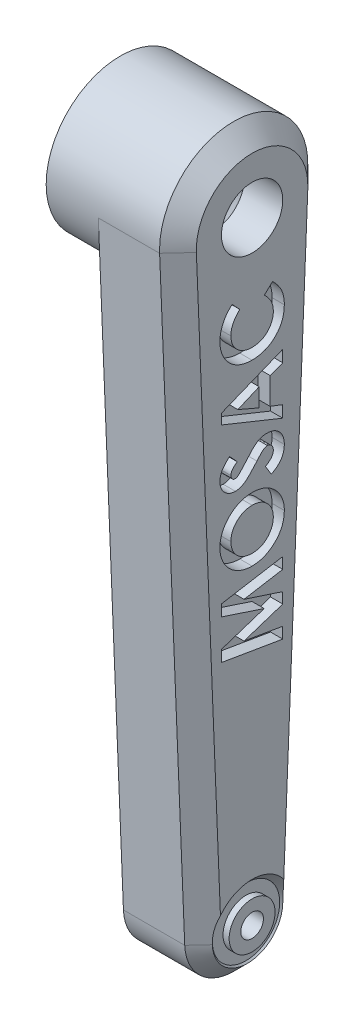
from build123d import *

# Parameters (mm, degrees)
BOSS_EXTRUDE1_DEPTH = 16
BOSS_EXTRUDE2_START = 5.5
SKETCH2_R           = 12.1
BOSS_EXTRUDE2_DEPTH = 5.5
SKETCH3_R           = 1.85
TORNILLO_INF_DEPTH  = 110.847212072
SKETCH4_R           = 1.75
TORNILLO_SUP_DEPTH  = 111.782038255
SKETCH6_R           = 10.8
SKETCH6_R_2         = 1.75
CUT_EXTRUDE4_DEPTH  = 4
SKETCH5_R           = 5
SKETCH5_R_2         = 1.65
CUT_EXTRUDE3_DEPTH  = 8.25
CHAMFER1_SIZE       = 2
CHAMFER2_SIZE       = 3
CHAMFER3_SIZE       = 3
MOSAC_DEPTH         = 2
SKETCH10_R          = 0.8
CUT_EXTRUDE5_DEPTH  = 10
SKETCH11_R          = 5.5
SKETCH11_R_2        = 3.75
CUT_EXTRUDE6_DEPTH  = 1


with BuildPart() as part:
    # Sketch1 → Boss-Extrude1 (new body)
    with BuildSketch(Plane(origin=(0, 0, 0), x_dir=(0, -1, 0), z_dir=(-1, 0, 0))):
        with BuildLine():
            Line((0.4961, -12.089825672), (100.328, -7.993273172))
            ThreePointArc((100.328, -7.993273172), (108, 0), (100.328, 7.993273172))
            Line((100.328, 7.993273172), (0.4961, 12.089825672))
            ThreePointArc((0.4961, 12.089825672), (-12.1, 0), (0.4961, -12.089825672))
        make_face()
    extrude(amount=-BOSS_EXTRUDE1_DEPTH)

    # Sketch2 → Boss-Extrude2 (add)
    with BuildSketch(Plane.ZY.offset(BOSS_EXTRUDE2_START)):
        Circle(SKETCH2_R)
    extrude(amount=-BOSS_EXTRUDE2_DEPTH)

    # Sketch3 → Tornillo_inf (cut, through all)
    with BuildSketch(Plane.ZY):
        with Locations(Location((0, -100, 0), (0, 0, 180))):
            Circle(SKETCH3_R)
    extrude(amount=-TORNILLO_INF_DEPTH, mode=Mode.SUBTRACT)

    # Sketch4 → Tornillo_sup (cut, through all)
    with BuildSketch(Plane.ZY.offset(5.5)):
        with Locations(Location((0, 0, 0), (0, 0, 180))):
            Circle(SKETCH4_R)
    extrude(amount=-TORNILLO_SUP_DEPTH, mode=Mode.SUBTRACT)

    # Sketch6 → Cut-Extrude4 (cut)
    with BuildSketch(Plane.ZY.offset(5.5)):
        with Locations(Location((0, 0, 0), (0, 0, 180))):
            Circle(SKETCH6_R)
        Circle(SKETCH6_R_2, mode=Mode.SUBTRACT)
    extrude(amount=-CUT_EXTRUDE4_DEPTH, mode=Mode.SUBTRACT)

    # Sketch5 → Cut-Extrude3 (cut)
    with BuildSketch(Plane(origin=(16, 0, 0), x_dir=(0, 0, -1), z_dir=(1, 0, 0))):
        with Locations(Location((0, 0, 0), (0, 0, 180))):
            Circle(SKETCH5_R)
        Circle(SKETCH5_R_2, mode=Mode.SUBTRACT)
    extrude(amount=-CUT_EXTRUDE3_DEPTH, mode=Mode.SUBTRACT)

    # Chamfer1
    chamfer1_edges = [part.edges().sort_by_distance(p)[0] for p in [
        (7.75, 0, -5),
    ]]
    chamfer(chamfer1_edges, length=CHAMFER1_SIZE)

    # Chamfer2
    # the kernel refuses this chamfer: 3 mm, written as the material it takes off along each edge
    with BuildSketch(Plane(origin=(0, -100.328, 7.993273172), x_dir=(1, 0, 0), z_dir=(0, 0.9991591464826812, 0.041000000000000016))) as chamfer2_piece_1_section:
        Polygon((CHAMFER2_SIZE, 0), (0, CHAMFER2_SIZE), (0, 0), align=None)
    chamfer2_piece_1 = extrude(amount=113.031497887, mode=Mode.PRIVATE)
    chamfer2_piece_1 = chamfer2_piece_1 - Plane(origin=(0, 0, 0), x_dir=(0, -0.041000000000000016, 0.9991591464826812), z_dir=(-1, 0, 0)) * Cylinder(12.1, 239, mode=Mode.PRIVATE)
    add(chamfer2_piece_1, mode=Mode.SUBTRACT)
    with BuildSketch(Plane(origin=(0, -100, 0), x_dir=(0, -0.041000000000003894, -0.9991591464826811), z_dir=(0, 0.9991591464826811, -0.041000000000003894))) as chamfer2_piece_2:
        Polygon((8, -CHAMFER2_SIZE), (8 - CHAMFER2_SIZE, 0), (8, 0), align=None)
    revolve(axis=Axis((0, -100, 0), (-1, 0, 0)), revolution_arc=175.300428789, mode=Mode.SUBTRACT)
    with BuildSketch(Plane(origin=(0, 12.608454954, -12.627564585), x_dir=(1, 0, 0), z_dir=(0, -0.9991591464826812, 0.041))) as chamfer2_piece_3_section:
        Polygon((CHAMFER2_SIZE, 0), (0, CHAMFER2_SIZE), (0, 0), align=None)
    chamfer2_piece_3 = extrude(amount=113.031497887, mode=Mode.PRIVATE)
    chamfer2_piece_3 = chamfer2_piece_3 - Plane(origin=(0, 0, 0), x_dir=(0, -0.041000000000000016, 0.9991591464826812), z_dir=(-1, 0, 0)) * Cylinder(12.1, 239, mode=Mode.PRIVATE)
    add(chamfer2_piece_3, mode=Mode.SUBTRACT)

    # Chamfer3
    # the kernel refuses this chamfer: 3 mm, written as the material it takes off along each edge
    with BuildSketch(Plane(origin=(16, -100, 0), x_dir=(0, -0.041000000000003894, -0.9991591464826811), z_dir=(0, 0.9991591464826811, -0.041000000000003894))) as chamfer3_piece_1:
        Polygon((8 - CHAMFER3_SIZE, 0), (8, CHAMFER3_SIZE), (8, 0), align=None)
    revolve(axis=Axis((16, -100, 0), (-1, 0, 0)), revolution_arc=175.300428789, mode=Mode.SUBTRACT)
    with BuildSketch(Plane(origin=(16, -100.328, 7.993273172), x_dir=(0, 0.041000000000000016, -0.9991591464826812), z_dir=(0, 0.9991591464826812, 0.041000000000000016)), Plane(origin=(16, -0.4961, -12.089825672), x_dir=(0, 0.040999999999999995, 0.9991591464826812), z_dir=(0, -0.9991591464826812, 0.041))) as chamfer3_piece_2:
        Polygon((CHAMFER3_SIZE, 0), (0, CHAMFER3_SIZE), (0, 0), align=None)
    extrude(amount=99.915914648, mode=Mode.SUBTRACT)
    with BuildSketch(Plane(origin=(16, 0, 0), x_dir=(0, -0.041000000000000016, 0.9991591464826812), z_dir=(0, -0.9991591464826812, -0.041000000000000016))) as chamfer3_piece_3:
        Polygon((12.1 - CHAMFER3_SIZE, 0), (12.1, CHAMFER3_SIZE), (12.1, 0), align=None)
    revolve(axis=Axis((16, 0, 0), (-1, 0, 0)), revolution_arc=184.699571211, mode=Mode.SUBTRACT)

    # Sketch9 → MOSAC (cut)
    # profile 1 of 5: a face of its own
    with BuildSketch(Plane(origin=(16, 0, 0), x_dir=(0, 0, -1), z_dir=(1, 0, 0))):
        with BuildLine():
            Line((-3.265224359, -10.641025641), (-2.007211538, -11.95713141))
            add(Edge.make_bspline(
                [(-2.007211538, -11.95713141), (-2.122670398, -12.068763826), (-2.348197722, -12.286816907), (-2.646445689, -12.638360029), (-2.896039484, -13.003018088), (-3.102028707, -13.377152323), (-3.264159895, -13.761494968), (-3.378804441, -14.157335015), (-3.449477952, -14.564094076), (-3.457502386, -14.839462049), (-3.461538462, -14.977964744)],
                knots=[0, 0, 0, 0, 1.115315123, 2.178559852, 3.196385012, 4.180486591, 5.141138664, 6.08807191, 7.038351522, 8, 8, 8, 8], degree=3))
            add(Edge.make_bspline(
                [(-3.461538462, -14.977964744), (-3.458340396, -15.093626948), (-3.452029365, -15.321873564), (-3.405651796, -15.656967742), (-3.327082201, -15.977624173), (-3.217871035, -16.284097259), (-3.080337556, -16.577902235), (-2.90746789, -16.856303257), (-2.705031769, -17.120796478), (-2.473383434, -17.368291517), (-2.218417825, -17.591726), (-1.949893333, -17.793043645), (-1.663060411, -17.95979365), (-1.36210196, -18.095911492), (-1.046909305, -18.20317548), (-0.717498223, -18.279305037), (-0.37312496, -18.323414553), (-0.139014085, -18.329990993), (-0.020032051, -18.333333333)],
                knots=[0, 0, 0, 0, 1.035268443, 2.04298821, 3.02163646, 3.985902049, 4.951223231, 5.920091634, 6.913651787, 7.92868536, 8.949353712, 9.945284791, 10.92850487, 11.913014323, 12.897904816, 13.904240668, 14.934873455, 16, 16, 16, 16], degree=3))
            add(Edge.make_bspline(
                [(-0.020032051, -18.333333333), (0.063474991, -18.33235513), (0.228069088, -18.330427071), (0.470931174, -18.309896989), (0.707046168, -18.275707578), (0.935846594, -18.228081492), (1.157631207, -18.167028798), (1.372919337, -18.096502415), (1.579144107, -18.00642222), (1.780166807, -17.907335194), (1.97114841, -17.79333868), (2.152214652, -17.668512149), (2.323406062, -17.534006), (2.484113945, -17.388023888), (2.632024799, -17.228727581), (2.771166034, -17.059964327), (2.899342845, -16.880057594), (3.014514105, -16.688935276), (3.121865929, -16.492380945), (3.210763566, -16.286345345), (3.290678247, -16.076591677), (3.350797897, -15.859438602), (3.403089354, -15.638711676), (3.435025359, -15.411338473), (3.459292504, -15.179476881), (3.460786586, -15.022770462), (3.461538462, -14.943910256)],
                knots=[0, 0, 0, 0, 1.103738238, 2.175490744, 3.219137561, 4.256155604, 5.262629953, 6.259184223, 7.247888397, 8.234817694, 9.220364322, 10.185094651, 11.140491148, 12.096499151, 13.05201798, 14.011605636, 14.986460005, 15.968997565, 16.960259839, 17.944382265, 18.933125845, 19.924977513, 20.920749559, 21.929466621, 22.958034467, 24, 24, 24, 24], degree=3))
            add(Edge.make_bspline(
                [(3.461538462, -14.943910256), (3.457684031, -14.81014541), (3.450111076, -14.547332269), (3.39045925, -14.161708182), (3.293379843, -13.793654423), (3.175427434, -13.500643614), (3.061055847, -13.270945977), (2.9582409, -13.094614001), (2.839711638, -12.914207467), (2.704975877, -12.730001121), (2.554622348, -12.540925796), (2.385713195, -12.350110431), (2.203708052, -12.152731266), (2.073811768, -12.023427728), (2.007211538, -11.95713141)],
                knots=[0, 0, 0, 0, 1.404693586, 2.759857621, 4.088769373, 5.395275838, 6.0697462, 6.783214465, 7.53810233, 8.336454657, 9.18000028, 10.074808326, 11.012918585, 12, 12, 12, 12], degree=3))
            Line((2.007211538, -11.95713141), (3.347355769, -10.681089744))
            add(Edge.make_bspline(
                [(3.347355769, -10.681089744), (3.433957203, -10.770788604), (3.602984682, -10.945861598), (3.84298793, -11.209954348), (4.058657528, -11.473714728), (4.257821337, -11.730770835), (4.434677233, -11.985333516), (4.589401843, -12.237375776), (4.725908376, -12.484044387), (4.841894718, -12.7304615), (4.940379168, -12.978160451), (5.025167815, -13.233013563), (5.09689596, -13.495799945), (5.154771154, -13.768124578), (5.201179245, -14.047447383), (5.232504439, -14.33638245), (5.253563324, -14.633097788), (5.255455639, -14.834364399), (5.256410256, -14.935897436)],
                knots=[0, 0, 0, 0, 1.244526981, 2.429050516, 3.560637417, 4.644440555, 5.67424972, 6.652764056, 7.595344123, 8.486817594, 9.369275933, 10.254498637, 11.166417451, 12.086725134, 13.032340136, 13.991389299, 14.986715468, 16, 16, 16, 16], degree=3))
            add(Edge.make_bspline(
                [(5.256410256, -14.935897436), (5.251655907, -15.122401047), (5.242352968, -15.487336773), (5.173424486, -16.022140563), (5.057867099, -16.530189808), (4.894437081, -17.012720496), (4.685662892, -17.469579194), (4.42971554, -17.900649023), (4.127275036, -18.305235195), (3.781886277, -18.68006945), (3.400433388, -19.019124872), (2.990857633, -19.318810601), (2.551146098, -19.566710647), (2.087794725, -19.772547397), (1.598689064, -19.933509028), (1.08330005, -20.046798729), (0.542125324, -20.116663661), (0.172490511, -20.124306984), (-0.016025641, -20.128205128)],
                knots=[0, 0, 0, 0, 1.078019885, 2.10938526, 3.111377082, 4.085535484, 5.04941344, 6.010039228, 6.978205633, 7.964457913, 8.951525778, 9.924444315, 10.892603023, 11.863865945, 12.85144698, 13.863884204, 14.910567087, 16, 16, 16, 16], degree=3))
            add(Edge.make_bspline(
                [(-0.016025641, -20.128205128), (-0.138977219, -20.126574198), (-0.382637196, -20.123342092), (-0.742174993, -20.088735451), (-1.09222087, -20.041730476), (-1.429783559, -19.964515279), (-1.75870541, -19.874749197), (-2.076075658, -19.759098917), (-2.383231183, -19.624736199), (-2.679784053, -19.471318919), (-2.962531891, -19.295602499), (-3.233277873, -19.10429402), (-3.488514775, -18.89275375), (-3.729294905, -18.663122748), (-3.958345513, -18.417522992), (-4.170033485, -18.151748265), (-4.370037908, -17.870331254), (-4.552393868, -17.571322534), (-4.718243478, -17.261535606), (-4.860928314, -16.942475764), (-4.983357132, -16.618256186), (-5.084153228, -16.287893792), (-5.159595852, -15.95080443), (-5.216647963, -15.609246813), (-5.248552504, -15.26035424), (-5.253774319, -15.026101683), (-5.256410256, -14.907852564)],
                knots=[0, 0, 0, 0, 1.071814294, 2.12407397, 3.147667899, 4.14936388, 5.141177959, 6.119239245, 7.091825145, 8.063277363, 9.028022524, 9.992609517, 10.952139039, 11.915934802, 12.892469547, 13.878248468, 14.87668965, 15.901326483, 16.93027266, 17.938917451, 18.9468897, 19.950817235, 20.948103127, 21.957084021, 22.968749718, 24, 24, 24, 24], degree=3))
            add(Edge.make_bspline(
                [(-5.256410256, -14.907852564), (-5.254897705, -14.806974508), (-5.251888328, -14.606267247), (-5.226846238, -14.307372217), (-5.187406226, -14.01090033), (-5.12831547, -13.717756918), (-5.056753843, -13.426623729), (-4.968609238, -13.138719663), (-4.861093479, -12.854838622), (-4.74215836, -12.572519584), (-4.606756902, -12.297392981), (-4.455201501, -12.031849849), (-4.291456992, -11.77523222), (-4.112706943, -11.529087071), (-3.921576961, -11.291680697), (-3.718073371, -11.063266406), (-3.498504671, -10.846036006), (-3.343377572, -10.7097079), (-3.265224359, -10.641025641)],
                knots=[0, 0, 0, 0, 0.996333415, 1.982307736, 2.96084097, 3.949129141, 4.93457382, 5.921430247, 6.92116383, 7.931890485, 8.946633814, 9.948019707, 10.950686436, 11.952094051, 12.951305284, 13.960287133, 14.972390273, 16, 16, 16, 16], degree=3))
        make_face()
    # profile 2 of 5: a face of its own
    with BuildSketch(Plane(origin=(16, 0, 0), x_dir=(0, 0, -1), z_dir=(1, 0, 0))):
        Polygon((-5, -26.79286859), (-5, -25.128205128), (5, -21.08974359), (5, -23.006810897), (2.948717949, -23.784054487), (2.948717949, -28.141025641), (5, -28.918269231), (5, -30.833333333), align=None)
        Polygon((-2.317708333, -25.961538462), (1.153846154, -27.459935897), (1.153846154, -24.463141026), align=None, mode=Mode.SUBTRACT)
    # profile 3 of 5: a face of its own
    with BuildSketch(Plane(origin=(16, 0, 0), x_dir=(0, 0, -1), z_dir=(1, 0, 0))):
        with BuildLine():
            Line((-3.663862179, -31.923076923), (-2.435897436, -33.265224359))
            add(Edge.make_bspline(
                [(-2.435897436, -33.265224359), (-2.516995655, -33.3227162), (-2.672692925, -33.433092518), (-2.881175241, -33.612001016), (-3.059026171, -33.79010165), (-3.205502736, -33.969044415), (-3.319714983, -34.150415391), (-3.400578516, -34.333899745), (-3.451984231, -34.518457252), (-3.45838548, -34.642451408), (-3.461538462, -34.703525641)],
                knots=[0, 0, 0, 0, 1.299362458, 2.494594718, 3.587462134, 4.587049575, 5.512617175, 6.380583204, 7.202344345, 8, 8, 8, 8], degree=3))
            add(Edge.make_bspline(
                [(-3.461538462, -34.703525641), (-3.45959999, -34.760522053), (-3.45585731, -34.870567149), (-3.416783301, -35.026713875), (-3.353641804, -35.167038087), (-3.2664219, -35.287801928), (-3.162256026, -35.384953812), (-3.051366369, -35.460495203), (-2.930460129, -35.504392453), (-2.847540513, -35.510029728), (-2.806490385, -35.512820513)],
                knots=[0, 0, 0, 0, 1.184157716, 2.286297433, 3.324836695, 4.370048774, 5.362957217, 6.276446515, 7.146738784, 8, 8, 8, 8], degree=3))
            add(Edge.make_bspline(
                [(-2.806490385, -35.512820513), (-2.764867563, -35.51105395), (-2.681044985, -35.507496337), (-2.558192557, -35.47313464), (-2.438151434, -35.421341752), (-2.36507669, -35.371851532), (-2.327724359, -35.346554487)],
                knots=[0, 0, 0, 0, 0.967525499, 1.948461899, 2.951351359, 4, 4, 4, 4], degree=3))
            add(Edge.make_bspline(
                [(-2.327724359, -35.346554487), (-2.298773648, -35.323467376), (-2.231747876, -35.270016822), (-2.123989566, -35.171101202), (-1.996621727, -35.04194101), (-1.846997936, -34.885746014), (-1.673697601, -34.703061091), (-1.479615566, -34.491053998), (-1.266639437, -34.248175725), (-1.116492345, -34.077822416), (-1.037660256, -33.98838141)],
                knots=[0, 0, 0, 0, 0.473854981, 1.097054127, 1.870604305, 2.795416232, 3.865517794, 5.093525133, 6.47400653, 8, 8, 8, 8], degree=3))
            add(Edge.make_bspline(
                [(-1.037660256, -33.98838141), (-0.964880502, -33.904243663), (-0.826759647, -33.744567698), (-0.630396888, -33.517668445), (-0.454526992, -33.316963476), (-0.297832993, -33.144278123), (-0.166767748, -32.99445214), (-0.053267944, -32.874111984), (0.037701295, -32.778107347), (0.092709732, -32.723587963), (0.116185897, -32.700320513)],
                knots=[0, 0, 0, 0, 1.543627419, 2.929484142, 4.163674036, 5.24627963, 6.164986907, 6.925413438, 7.541394495, 8, 8, 8, 8], degree=3))
            add(Edge.make_bspline(
                [(0.116185897, -32.700320513), (0.211733122, -32.612044602), (0.395408443, -32.442347299), (0.679975362, -32.221665515), (0.957525594, -32.040836138), (1.232594987, -31.899311887), (1.511534608, -31.79340993), (1.800360209, -31.7192166), (2.101264754, -31.674106208), (2.306200839, -31.66916559), (2.409855769, -31.666666667)],
                knots=[0, 0, 0, 0, 1.206593015, 2.319495511, 3.336910718, 4.276265636, 5.184178927, 6.099356736, 7.038670786, 8, 8, 8, 8], degree=3))
            add(Edge.make_bspline(
                [(2.409855769, -31.666666667), (2.510851259, -31.668456682), (2.709008167, -31.671968758), (2.998981296, -31.714984948), (3.276498131, -31.776323526), (3.538539053, -31.871163672), (3.789404813, -31.986754471), (4.025189841, -32.131663515), (4.248272334, -32.301841986), (4.454695065, -32.496882459), (4.641919285, -32.712658472), (4.808922891, -32.943958714), (4.945710144, -33.193930913), (5.062856754, -33.457596414), (5.146220452, -33.739769016), (5.21180528, -34.035305957), (5.250228899, -34.347279021), (5.254320117, -34.560526379), (5.256410256, -34.669471154)],
                knots=[0, 0, 0, 0, 1.043169307, 2.046737005, 3.02462096, 3.976528701, 4.921503154, 5.875710796, 6.831116189, 7.817539083, 8.805892356, 9.780872653, 10.7604363, 11.74661763, 12.757588865, 13.796088471, 14.874055702, 16, 16, 16, 16], degree=3))
            add(Edge.make_bspline(
                [(5.256410256, -34.669471154), (5.254894093, -34.75499807), (5.251891221, -34.924390414), (5.227340535, -35.174041019), (5.187804518, -35.415137938), (5.130836659, -35.64726533), (5.059639183, -35.872239293), (4.968748943, -36.087866825), (4.864261805, -36.295697547), (4.74393265, -36.495304242), (4.604100618, -36.685428196), (4.450239656, -36.87139756), (4.274895994, -37.047086541), (4.081473928, -37.216432453), (3.868787191, -37.377250006), (3.640063154, -37.535029759), (3.390981258, -37.682696067), (3.216251359, -37.773918452), (3.127003205, -37.820512821)],
                knots=[0, 0, 0, 0, 1.016956594, 2.014157282, 2.980233409, 3.920138626, 4.854357287, 5.783465618, 6.699725051, 7.61900777, 8.551402113, 9.504102091, 10.486778735, 11.499758944, 12.559144124, 13.656050795, 14.802762778, 16, 16, 16, 16], degree=3))
            Line((3.127003205, -37.820512821), (2.179487179, -36.241987179))
            add(Edge.make_bspline(
                [(2.179487179, -36.241987179), (2.28079579, -36.183704863), (2.475013056, -36.071972682), (2.735968567, -35.882632056), (2.959433767, -35.68866225), (3.141458893, -35.485578857), (3.284477855, -35.275851295), (3.386689127, -35.058466531), (3.449957789, -34.833271834), (3.457684354, -34.679879437), (3.461538462, -34.603365385)],
                knots=[0, 0, 0, 0, 1.283663364, 2.460892379, 3.537111102, 4.529833553, 5.449777664, 6.316464042, 7.160231139, 8, 8, 8, 8], degree=3))
            add(Edge.make_bspline(
                [(3.461538462, -34.603365385), (3.458390988, -34.525539639), (3.452284432, -34.374546358), (3.395880012, -34.159022771), (3.307320934, -33.961422586), (3.180959342, -33.790618446), (3.035118859, -33.645992269), (2.872864653, -33.539249848), (2.69730952, -33.47219354), (2.575357376, -33.465104063), (2.514022436, -33.461538462)],
                knots=[0, 0, 0, 0, 1.13588714, 2.203786484, 3.234766741, 4.283437687, 5.291419208, 6.222934724, 7.106237994, 8, 8, 8, 8], degree=3))
            add(Edge.make_bspline(
                [(2.514022436, -33.461538462), (2.456960255, -33.464831148), (2.341043897, -33.471519926), (2.168694913, -33.520787399), (1.99642431, -33.597807488), (1.8551233, -33.688927685), (1.736815795, -33.781653894), (1.634307694, -33.870321065), (1.521054187, -33.978294224), (1.396912812, -34.105299598), (1.26079072, -34.249659116), (1.11270124, -34.411494381), (0.953948864, -34.592658579), (0.845808314, -34.720705791), (0.789262821, -34.787660256)],
                knots=[0, 0, 0, 0, 0.916159276, 1.861089862, 2.860218735, 3.940849679, 4.552606315, 5.27541173, 6.11797699, 7.06649574, 8.129236253, 9.306560635, 10.591630461, 12, 12, 12, 12], degree=3))
            add(Edge.make_bspline(
                [(0.789262821, -34.787660256), (0.681569185, -34.914943467), (0.474872501, -35.159238475), (0.169586796, -35.504456619), (-0.115726414, -35.815535036), (-0.384612677, -36.089760965), (-0.632047317, -36.330712197), (-0.860226964, -36.536493808), (-1.070758671, -36.70600298), (-1.321791003, -36.881952339), (-1.624971142, -37.051154693), (-1.989500962, -37.197668112), (-2.354351525, -37.291829928), (-2.599628857, -37.302460177), (-2.720352564, -37.307692308)],
                knots=[0, 0, 0, 0, 1.345561566, 2.582539916, 3.71901348, 4.751744315, 5.681651107, 6.506005906, 7.230637833, 7.861516384, 8.978504332, 10.023243174, 11.027054763, 12, 12, 12, 12], degree=3))
            add(Edge.make_bspline(
                [(-2.720352564, -37.307692308), (-2.805967161, -37.305523139), (-2.974637114, -37.301249643), (-3.222642365, -37.263130738), (-3.461944021, -37.206157451), (-3.69168116, -37.123427353), (-3.911520685, -37.016012139), (-4.122711115, -36.885716155), (-4.323035439, -36.729488735), (-4.514464168, -36.555668889), (-4.687609993, -36.361848506), (-4.840349848, -36.155592802), (-4.970052475, -35.937806368), (-5.074168603, -35.707650092), (-5.156816218, -35.467003852), (-5.214714185, -35.215259678), (-5.249330876, -34.952890506), (-5.254021063, -34.774411335), (-5.256410256, -34.68349359)],
                knots=[0, 0, 0, 0, 1.010608097, 1.99100651, 2.956992389, 3.912457524, 4.868345712, 5.842283282, 6.837666818, 7.864758285, 8.892394644, 9.901925088, 10.892014243, 11.880216914, 12.880338321, 13.892361018, 14.926363314, 16, 16, 16, 16], degree=3))
            add(Edge.make_bspline(
                [(-5.256410256, -34.68349359), (-5.252100165, -34.565670975), (-5.243514004, -34.330955795), (-5.176369764, -33.983924297), (-5.070787022, -33.644951741), (-4.943385989, -33.371822721), (-4.820034194, -33.154448374), (-4.706284099, -32.988005034), (-4.576473449, -32.817650061), (-4.426943603, -32.646020341), (-4.262599215, -32.468949596), (-4.079652016, -32.289053858), (-3.879984047, -32.104416827), (-3.737164842, -31.984582489), (-3.663862179, -31.923076923)],
                knots=[0, 0, 0, 0, 1.282949271, 2.555771389, 3.837399776, 5.142782039, 5.830402679, 6.558840402, 7.337330299, 8.162747002, 9.037840561, 9.968992266, 10.957575255, 12, 12, 12, 12], degree=3))
        make_face()
    # profile 4 of 5: a face of its own
    with BuildSketch(Plane(origin=(16, 0, 0), x_dir=(0, 0, -1), z_dir=(1, 0, 0))):
        with BuildLine():
            add(Edge.make_bspline(
                [(-5.256410256, -44.018429487), (-5.251907775, -43.84456777), (-5.243018858, -43.501325362), (-5.168949834, -42.996530315), (-5.048197682, -42.510103166), (-4.880581642, -42.042092129), (-4.660670104, -41.594623488), (-4.398546843, -41.163336098), (-4.082818236, -40.753692452), (-3.724729187, -40.367107798), (-3.335069477, -40.009947248), (-2.915545991, -39.700546389), (-2.47668579, -39.435977586), (-2.016825689, -39.218320326), (-1.534397861, -39.051130011), (-1.031412607, -38.934318888), (-0.507733702, -38.859177697), (-0.151168784, -38.850542506), (0.030048077, -38.846153846)],
                knots=[0, 0, 0, 0, 1.014235534, 2.002330665, 2.970116157, 3.9352621, 4.897279957, 5.875024536, 6.875755618, 7.909865842, 8.947091691, 9.955591861, 10.946663836, 11.933282567, 12.91916997, 13.920121047, 14.942943865, 16, 16, 16, 16], degree=3))
            add(Edge.make_bspline(
                [(0.030048077, -38.846153846), (0.209222483, -38.850829097), (0.562291399, -38.860041829), (1.081152398, -38.931236763), (1.578720248, -39.050089684), (2.056006308, -39.213989114), (2.510603863, -39.428079025), (2.944410473, -39.688121295), (3.35593834, -39.99685528), (3.743453404, -40.34688369), (4.097598256, -40.729848741), (4.407649228, -41.137738391), (4.670313656, -41.565691591), (4.886615815, -42.013373172), (5.049783973, -42.484009141), (5.171798855, -42.972286978), (5.242381063, -43.482178034), (5.251686828, -43.828580025), (5.256410256, -44.004407051)],
                knots=[0, 0, 0, 0, 1.051628416, 2.072267533, 3.067761847, 4.050852917, 5.029392597, 6.012272624, 7.015026456, 8.044749159, 9.073964344, 10.072810436, 11.047668484, 12.017263184, 12.98554948, 13.966731695, 14.967951888, 16, 16, 16, 16], degree=3))
            add(Edge.make_bspline(
                [(5.256410256, -44.004407051), (5.252222258, -44.188314896), (5.243993415, -44.549668672), (5.166400989, -45.078642814), (5.048101004, -45.584723447), (4.876831089, -46.066523897), (4.654289681, -46.523669619), (4.385587912, -46.958210717), (4.065535441, -47.366879056), (3.703785592, -47.748312425), (3.307849261, -48.093851726), (2.889604278, -48.398868459), (2.452213582, -48.656154197), (1.995480821, -48.865722158), (1.522242297, -49.030936947), (1.029616428, -49.147477252), (0.518784555, -49.216320381), (0.171817341, -49.22590983), (-0.00400641, -49.230769231)],
                knots=[0, 0, 0, 0, 1.067953136, 2.098381936, 3.099641766, 4.083805132, 5.062469929, 6.048665414, 7.046702845, 8.073106546, 9.098695993, 10.09591865, 11.076726721, 12.041940862, 13.011263376, 13.984305721, 14.978557872, 16, 16, 16, 16], degree=3))
            add(Edge.make_bspline(
                [(-0.00400641, -49.230769231), (-0.122291255, -49.229243625), (-0.357363188, -49.22621173), (-0.705730803, -49.189706598), (-1.047286963, -49.137115899), (-1.380725369, -49.059462585), (-1.708793046, -48.964516989), (-2.028567275, -48.843112764), (-2.34221663, -48.703141644), (-2.646225737, -48.541308436), (-2.937092877, -48.3583553), (-3.217318592, -48.162980138), (-3.47956919, -47.947743624), (-3.726641717, -47.717044516), (-3.957589769, -47.470111669), (-4.172173275, -47.20644728), (-4.372848112, -46.927945191), (-4.556950235, -46.634579792), (-4.719685751, -46.328520933), (-4.865416261, -46.016522336), (-4.985048051, -45.697287459), (-5.083545079, -45.372687158), (-5.162699394, -45.043180186), (-5.215305333, -44.706147564), (-5.251795941, -44.364453841), (-5.254868501, -44.134044667), (-5.256410256, -44.018429487)],
                knots=[0, 0, 0, 0, 1.034634222, 2.056167603, 3.061938024, 4.056975325, 5.049831446, 6.048294015, 7.047371884, 8.053753139, 9.058980286, 10.052730068, 11.041053953, 12.024946181, 13.008838409, 13.997162294, 14.997691456, 16.01096975, 17.025258359, 18.029177048, 19.022170708, 20.005507574, 20.996177714, 21.984639769, 22.988728483, 24, 24, 24, 24], degree=3))
        make_face()
        with BuildLine():
            add(Edge.make_bspline(
                [(-3.461538462, -44.046474359), (-3.45839884, -44.163483634), (-3.452202483, -44.39441312), (-3.404994627, -44.73314462), (-3.329598314, -45.058338823), (-3.220387676, -45.368193047), (-3.081390252, -45.664050229), (-2.913091715, -45.946434832), (-2.709706992, -46.211436412), (-2.482154901, -46.46258851), (-2.228609577, -46.689463103), (-1.956892643, -46.889913963), (-1.667457861, -47.057659046), (-1.362994012, -47.198146605), (-1.04007748, -47.3039026), (-0.701237706, -47.379229424), (-0.345890852, -47.426833165), (-0.103651364, -47.432833676), (0.020032051, -47.435897436)],
                knots=[0, 0, 0, 0, 1.033739768, 2.040188636, 3.016340934, 3.979330865, 4.937572243, 5.900995986, 6.878200029, 7.884839167, 8.891893314, 9.879764717, 10.863503415, 11.843163062, 12.837761627, 13.859916423, 14.907309254, 16, 16, 16, 16], degree=3))
            add(Edge.make_bspline(
                [(0.020032051, -47.435897436), (0.157097138, -47.431826037), (0.425721997, -47.423846771), (0.817651709, -47.36796326), (1.188140075, -47.271499718), (1.535347541, -47.134701772), (1.861229594, -46.961323788), (2.163949811, -46.748960059), (2.4449318, -46.497644898), (2.609023852, -46.304141077), (2.692307692, -46.205929487)],
                knots=[0, 0, 0, 0, 1.078420897, 2.113526272, 3.107597235, 4.084297302, 5.043369457, 6.005430726, 6.9876695, 8, 8, 8, 8], degree=3))
            add(Edge.make_bspline(
                [(2.692307692, -46.205929487), (2.753831519, -46.125468691), (2.875493031, -45.966359895), (3.031427217, -45.712387616), (3.165078369, -45.450846177), (3.273066919, -45.179761922), (3.358008897, -44.899707366), (3.417492368, -44.610720913), (3.45482339, -44.313212032), (3.459285154, -44.112022584), (3.461538462, -44.010416667)],
                knots=[0, 0, 0, 0, 1.023928204, 2.024787132, 3.009472467, 3.9914905, 4.972207045, 5.96565515, 6.972602802, 8, 8, 8, 8], degree=3))
            add(Edge.make_bspline(
                [(3.461538462, -44.010416667), (3.45836756, -43.895421724), (3.45212871, -43.669165558), (3.40556855, -43.336706098), (3.326414552, -43.018355765), (3.218969725, -42.71112496), (3.074813231, -42.419272051), (2.904506576, -42.138154198), (2.699801283, -41.872672165), (2.467454471, -41.622922864), (2.213018166, -41.393844912), (1.941211978, -41.191754892), (1.654564995, -41.021250391), (1.353124634, -40.881834101), (1.037222181, -40.772625033), (0.705889915, -40.698060394), (0.36063741, -40.650093773), (0.125697078, -40.644086151), (0.006009615, -40.641025641)],
                knots=[0, 0, 0, 0, 1.026460056, 2.019592442, 2.989754624, 3.951362471, 4.919177453, 5.890456226, 6.881277895, 7.906300149, 8.932084862, 9.933608786, 10.925308803, 11.904168404, 12.893913482, 13.903284022, 14.931853825, 16, 16, 16, 16], degree=3))
            add(Edge.make_bspline(
                [(0.006009615, -40.641025641), (-0.112993966, -40.644181166), (-0.347234367, -40.650392336), (-0.691537031, -40.697215768), (-1.021019647, -40.77505813), (-1.336531537, -40.885074266), (-1.639729114, -41.02213148), (-1.927980885, -41.194298157), (-2.201037459, -41.397842499), (-2.457275482, -41.629043545), (-2.692757596, -41.880650279), (-2.897109244, -42.15078616), (-3.074685373, -42.43187956), (-3.21379109, -42.730383515), (-3.324616388, -43.040190005), (-3.40622971, -43.363189722), (-3.451870846, -43.700605983), (-3.458287198, -43.930157245), (-3.461538462, -44.046474359)],
                knots=[0, 0, 0, 0, 1.055040155, 2.076685641, 3.074845078, 4.052329834, 5.035358467, 6.020382375, 7.023447318, 8.050688466, 9.077178457, 10.074336316, 11.0503314, 12.019748348, 12.988025369, 13.964577102, 14.968620271, 16, 16, 16, 16], degree=3))
        make_face(mode=Mode.SUBTRACT)
    # profile 5 of 5: a face of its own
    with BuildSketch(Plane(origin=(16, 0, 0), x_dir=(0, 0, -1), z_dir=(1, 0, 0))):
        Polygon((-5, -60.362580128), (-5, -58.499599359), (1.975160256, -56.217948718), (-5, -53.920272436), (-5, -52.075320513), (5, -50.384615385), (5, -52.201522436), (-1.316105769, -53.269230769), (5, -55.348557692), (5, -57.099358974), (-1.316105769, -59.166666667), (5, -60.232371795), (5, -62.051282051), align=None)
    extrude(amount=-MOSAC_DEPTH, mode=Mode.SUBTRACT)

    # Sketch10 → Cut-Extrude5 (cut)
    with BuildSketch(Plane.ZY.offset(1.5)):
        with Locations((0, 7.8)):
            Circle(SKETCH10_R)
        with Locations((7.8, 0)):
            Circle(SKETCH10_R)
        with Locations((0, -7.8)):
            Circle(SKETCH10_R)
        with Locations((-7.8, 0)):
            Circle(SKETCH10_R)
    extrude(amount=-CUT_EXTRUDE5_DEPTH, mode=Mode.SUBTRACT)

    # Sketch11 → Cut-Extrude6 (cut)
    with BuildSketch(Plane(origin=(16, 0, 0), x_dir=(0, 0, -1), z_dir=(1, 0, 0))):
        with Locations((0, -100)):
            Circle(SKETCH11_R)
        with Locations((0, -100)):
            Circle(SKETCH11_R_2, mode=Mode.SUBTRACT)
    cut_extrude6 = extrude(amount=-CUT_EXTRUDE6_DEPTH, mode=Mode.SUBTRACT)

    # Mirror1: Cut-Extrude6 across plane
    add(cut_extrude6.mirror(Plane.ZY.offset(-8)), mode=Mode.SUBTRACT)

    # Chamfer4: read off the stored shape, not the designer's step
    # Chamfer4 outline → Chamfer4 (revolve, cut)
    with BuildSketch(Plane(origin=(0, -100, 0), x_dir=(0, 1, 0), z_dir=(0, 0, -1))):
        Polygon((5.5, 16), (5.5, 15), (6.5, 16), align=None)
        Polygon((6.5, 0), (5.5, 1), (5.5, 0), align=None)
    revolve(axis=Axis((0, -100, 0), (1, 0, 0)), mode=Mode.SUBTRACT)


solid = part.part
